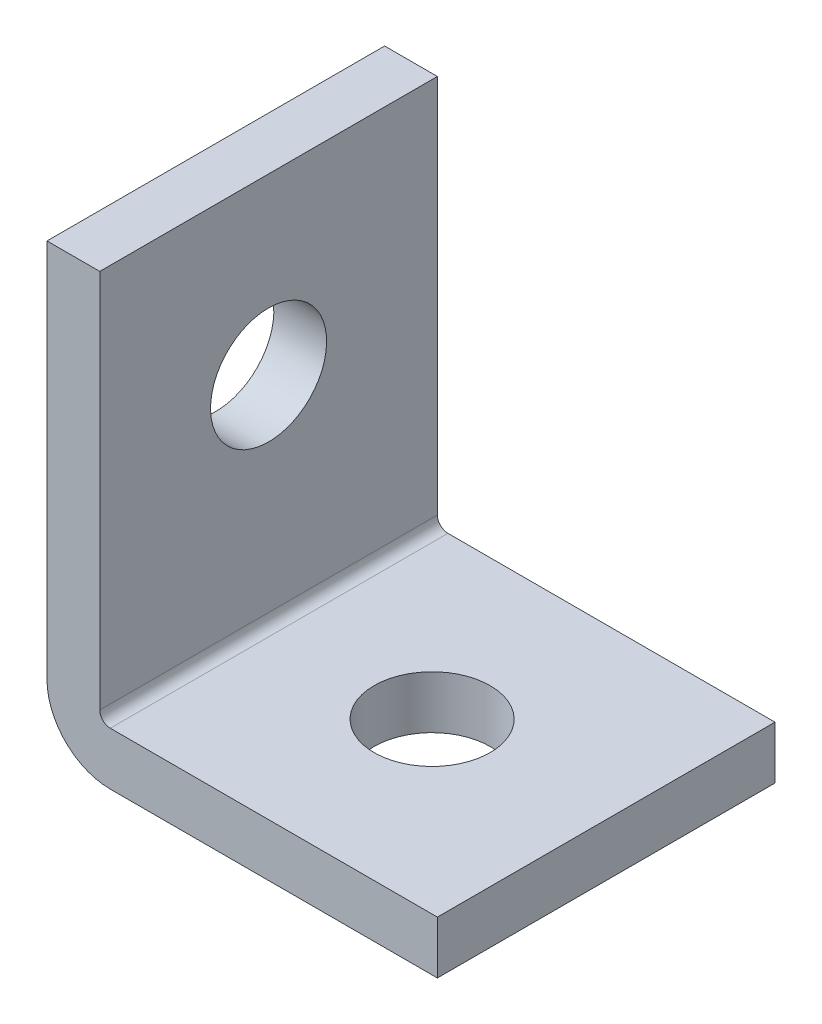
from build123d import *

# Parameters (mm, degrees)
BOSS_EXTRUDE1_DEPTH = 20.32
CUT_EXTRUDE1_REACH  = 67.365
SKETCH2_R           = 6.985
CUT_EXTRUDE2_REACH  = 67.365
SKETCH3_R           = 6.985


with BuildPart() as part:
    # Sketch1 → Boss-Extrude1 (new, symmetric)
    with BuildSketch(Plane.XY):
        with BuildLine():
            Line((0, 1.27), (0, 46.99))
            Line((0, 46.99), (-6.35, 46.99))
            Line((-6.35, 46.99), (-6.35, 1.27))
            ThreePointArc((-6.35, 1.27), (-4.118153673, -4.118153673), (1.27, -6.35))
            Line((1.27, -6.35), (40.64, -6.35))
            Line((40.64, -6.35), (40.64, 0))
            Line((40.64, 0), (1.27, 0))
            ThreePointArc((1.27, 0), (0.371974388, 0.371974388), (0, 1.27))
        make_face()
    extrude(amount=BOSS_EXTRUDE1_DEPTH, both=True)

    # Sketch2 → Cut-Extrude1 (cut, up to next)
    with BuildSketch(Plane(origin=(0, 0, 0), x_dir=(0, 0, -1), z_dir=(1, 0, 0)), mode=Mode.PRIVATE) as cut_extrude1_sk1:
        with Locations((0, 26.035)):
            Circle(SKETCH2_R)
    cut_extrude1_tool1 = extrude(cut_extrude1_sk1.sketch, amount=-CUT_EXTRUDE1_REACH, mode=Mode.PRIVATE) & part.part
    add(cut_extrude1_tool1.solids().sort_by_distance((0, 26.035, 0))[0], mode=Mode.SUBTRACT)

    # Sketch3 → Cut-Extrude2 (cut, up to next)
    with BuildSketch(Plane(origin=(0, 0, 0), x_dir=(1, 0, 0), z_dir=(0, 1, 0)), mode=Mode.PRIVATE) as cut_extrude2_sk1:
        with Locations((19.685, 0)):
            Circle(SKETCH3_R)
    cut_extrude2_tool1 = extrude(cut_extrude2_sk1.sketch, amount=-CUT_EXTRUDE2_REACH, mode=Mode.PRIVATE) & part.part
    add(cut_extrude2_tool1.solids().sort_by_distance((19.685, 0, 0))[0], mode=Mode.SUBTRACT)


solid = part.part
